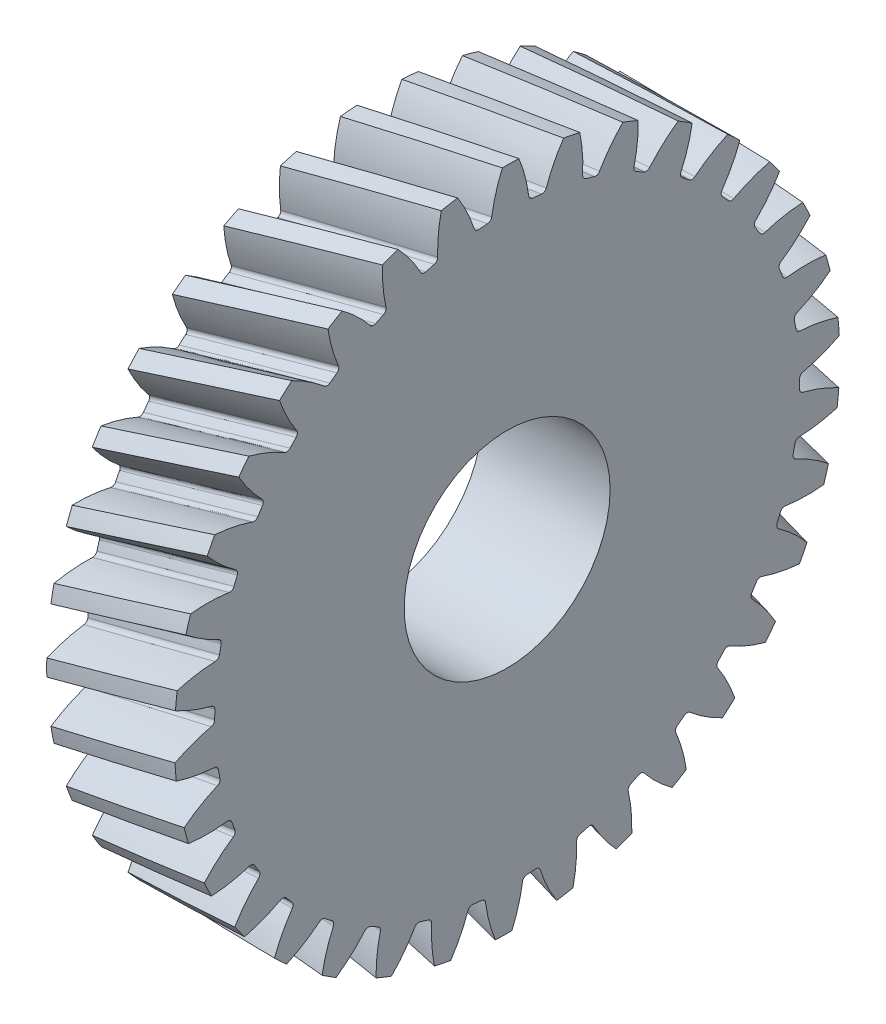
from build123d import *

# Parameters (mm, degrees)
BASPROSKE_W            = 25
BASPROSKE_H            = 65.098932734
TOOTHCUTLH_PITCH       = 1526.515732176
TOOTHCUTLH_HEIGHT      = 25
TOOTHCUTLH_RADIUS      = 65.098932734
TOOTHCUTLH_START_ANGLE = -90
TEETHCUTSLH_COUNT      = 34
TEETHCUTSLH_ANGLE      = 349.411764706
BORSKE_R               = 20
BORE_DEPTH             = 62.5000025
SKETCH3_R              = 20.15
CUT_EXTRUDE1_DEPTH     = 96.397809814


with BuildPart() as part:
    # BasProSke → Base-Revolve (revolve)
    with BuildSketch(Plane(origin=(0, 0, 0), x_dir=(1, 0, 0), z_dir=(0, 1, 0)), mode=Mode.PRIVATE) as base_revolve_sk:
        with Locations((12.5, 32.549466367)):
            Rectangle(BASPROSKE_W, BASPROSKE_H)
    revolve(base_revolve_sk.sketch.rotate(Axis((-10, 0, 0), (1, 0, 0)), 180), axis=Axis((-10, 0, 0), (1, 0, 0)))

    # ToothCutLH: sweep along a helix
    with BuildLine() as toothcutlh_path:
        add(Helix(TOOTHCUTLH_PITCH, TOOTHCUTLH_HEIGHT, TOOTHCUTLH_RADIUS, center=(0, 0, 0), direction=(1, 0, 0), lefthand=True, mode=Mode.PRIVATE).rotate(Axis((0, 0, 0), (1, 0, 0)), TOOTHCUTLH_START_ANGLE))
    # TooCutSkeRH<3> → ToothCutLH (sweep, cut)
    with BuildSketch(Plane(origin=(0, 0, 0), x_dir=(0, 0, -1), z_dir=(1, 0, 0))):
        with BuildLine():
            ThreePointArc((0.859422999, 57.217478708), (0, 57.223932734), (-0.859422999, 57.217478708))
            ThreePointArc((-0.859422999, 57.217478708), (-1.410298997, 57.401835612), (-1.724713988, 57.890297531))
            ThreePointArc((-1.724713988, 57.890297531), (-3.23499161, 62.512924247), (-5.478201344, 66.827738999))
            ThreePointArc((-5.478201344, 66.827738999), (0, 67.051900716), (5.478201344, 66.827738999))
            ThreePointArc((5.478201344, 66.827738999), (3.23499161, 62.512924247), (1.724713988, 57.890297531))
            ThreePointArc((1.724713988, 57.890297531), (1.410298997, 57.401835612), (0.859422999, 57.217478708))
        make_face()
    toothcutlh = sweep(path=toothcutlh_path.line, is_frenet=True, mode=Mode.SUBTRACT)

    # TeethCutsLH: ToothCutLH ×34 about axis
    teethcutslh_axis = Axis((-10, 0, 0), (1, 0, 0))
    for i in range(1, TEETHCUTSLH_COUNT):
        add(toothcutlh.rotate(teethcutslh_axis, i * TEETHCUTSLH_ANGLE / (TEETHCUTSLH_COUNT - 1)), mode=Mode.SUBTRACT)

    # BorSke → Bore (cut, symmetric)
    with BuildSketch(Plane(origin=(0, 0, 0), x_dir=(0, 0, -1), z_dir=(1, 0, 0))):
        with Locations(Location((0, 0, 0), (0, 0, 180))):
            Circle(BORSKE_R)
    extrude(amount=BORE_DEPTH, both=True, mode=Mode.SUBTRACT)

    # Sketch3 → Cut-Extrude1 (cut, through all)
    with BuildSketch(Plane(origin=(25, 0, 0), x_dir=(0, 0, -1), z_dir=(1, 0, 0))):
        Circle(SKETCH3_R)
    extrude(amount=-CUT_EXTRUDE1_DEPTH, mode=Mode.SUBTRACT)


solid = part.part
